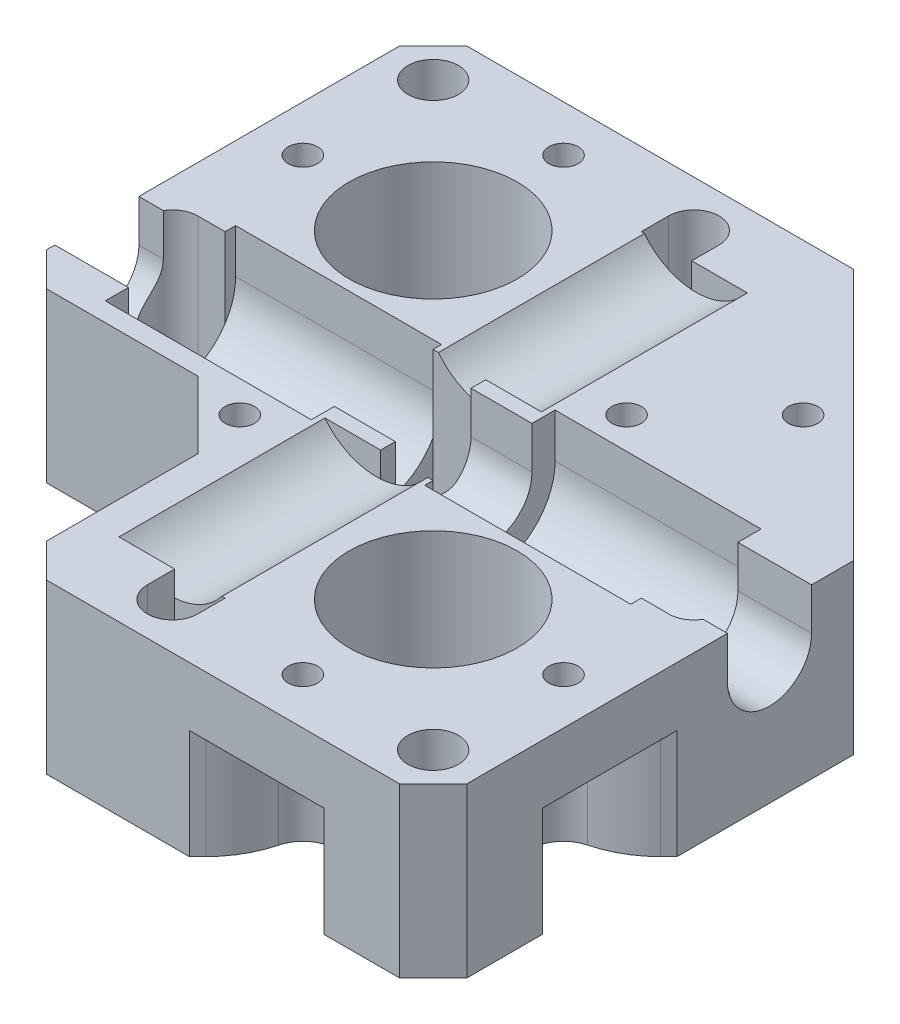
from build123d import *
from build123d.topology import SkipClean

# Parameters (mm, degrees)
SKETCH1_W               = 80
SKETCH1_H               = 80
BOSS_EXTRUDE1_DEPTH     = 20
CUT_EXTRUDE1_DEPTH      = 61
CUT_EXTRUDE1_DEPTH_BACK = 61
SKETCH2_R               = 1.75
SKETCH3_W               = 24.5
SKETCH3_H               = 15.5
CUT_EXTRUDE2_DEPTH      = 13
FILLET1_R               = 7.75
SKETCH4_W               = 15.5
SKETCH4_H               = 24.5
CUT_EXTRUDE3_DEPTH      = 3
BOSS_EXTRUDE2_DEPTH     = 23.5
CUT_EXTRUDE4_DEPTH      = 61
CUT_EXTRUDE4_DEPTH_BACK = 61
CUT_EXTRUDE5_DEPTH      = 61
CUT_EXTRUDE5_DEPTH_BACK = 61
SKETCH7_R               = 10
BOSS_EXTRUDE3_DEPTH     = 1.5
CUT_EXTRUDE6_DEPTH      = 61
CUT_EXTRUDE6_DEPTH_BACK = 61
CHAMFER1_SIZE           = 4
CHAMFER2_SIZE           = 30
CUT_EXTRUDE7_DEPTH      = 61
CUT_EXTRUDE7_DEPTH_BACK = 61
SKETCH10_R              = 1.75
SKETCH12_R              = 3
SKETCH12_R_2            = 1.75
CUT_EXTRUDE12_DEPTH     = 8
CUT_EXTRUDE13_START     = -3
SKETCH13_R              = 11
SKETCH13_R_2            = 10
CUT_EXTRUDE13_DEPTH     = 3
CUT_EXTRUDE14_START     = -16
SKETCH14_R              = 1.75
CUT_EXTRUDE14_DEPTH     = 16
CUT_EXTRUDE15_START     = -13
SKETCH15_R              = 1.75
SKETCH15_W              = 8
SKETCH15_H              = 5.5
SKETCH15_R_2            = 4
SKETCH15_W_2            = 5.5
SKETCH15_H_2            = 8
CUT_EXTRUDE15_DEPTH     = 13
CHAMFER3_SIZE           = 4
FILLET2_R               = 12
CUT_EXTRUDE19_DEPTH     = 17


# Some blends are built 0.0001 mm under size
with BuildPart() as part:
    # Sketch1 → Boss-Extrude1 (new body)
    with BuildSketch(Plane(origin=(0, 0, 0), x_dir=(1, 0, 0), z_dir=(0, 1, 0))):
        Rectangle(SKETCH1_W, SKETCH1_H)
    extrude(amount=-BOSS_EXTRUDE1_DEPTH)

    # Sketch2 → Cut-Extrude1 (cut, two sides: drawn at the far end of the back side and taken through both)
    with BuildSketch(Plane(origin=(0, 0, 0), x_dir=(1, 0, 0), z_dir=(0, 1, 0)).offset(-CUT_EXTRUDE1_DEPTH_BACK)):
        with Locations(Location((-11.5, -11.5, 0), (0, 0, 270))):
            Circle(SKETCH2_R)
        with Locations(Location((11.5, 11.5, 0), (0, 0, 270))):
            Circle(SKETCH2_R)
        with Locations(Location((22, 22, 0), (0, 0, 270))):
            Circle(SKETCH2_R)
        with Locations(Location((19, -34.5, 0), (0, 0, 270))):
            Circle(SKETCH2_R)
        with Locations(Location((34.5, -19, 0), (0, 0, 270))):
            Circle(SKETCH2_R)
        with Locations(Location((-34.5, 19, 0), (0, 0, 270))):
            Circle(SKETCH2_R)
        with Locations(Location((-19, 34.5, 0), (0, 0, 270))):
            Circle(SKETCH2_R)
    extrude(amount=CUT_EXTRUDE1_DEPTH + CUT_EXTRUDE1_DEPTH_BACK, mode=Mode.SUBTRACT)

    # Sketch3 → Cut-Extrude2 (cut)
    with BuildSketch(Plane(origin=(0, 0, 0), x_dir=(1, 0, 0), z_dir=(0, 1, 0))):
        with Locations((19, 0)):
            Rectangle(SKETCH3_W, SKETCH3_H)
        with Locations((-19, 0)):
            Rectangle(SKETCH3_W, SKETCH3_H)
    extrude(amount=-CUT_EXTRUDE2_DEPTH, mode=Mode.SUBTRACT)

    # Fillet1
    fillet1_edges = [part.edges().sort_by_distance(p)[0] for p in [
        (19, -13, 7.75),
        (19, -13, -7.75),
        (-19, -13, 7.75),
        (-19, -13, -7.75),
    ]]
    fillet(fillet1_edges, radius=FILLET1_R - 0.0001)  # a hair under: the kernel refuses the full size

    # Sketch4 → Cut-Extrude3 (cut)
    with BuildSketch(Plane(origin=(0, 0, 0), x_dir=(1, 0, 0), z_dir=(0, 1, 0))):
        with Locations((0, -19)):
            Rectangle(SKETCH4_W, SKETCH4_H)
        with Locations((0, 19)):
            Rectangle(SKETCH4_W, SKETCH4_H)
    extrude(amount=-CUT_EXTRUDE3_DEPTH, mode=Mode.SUBTRACT)

    # Sketch5 → Boss-Extrude2 (add)
    with BuildSketch(Plane(origin=(0, 0, 31.25), x_dir=(-1, 0, 0), z_dir=(0, 0, -1))):
        with BuildLine():
            ThreePointArc((-8e-09, -3), (-3.409545428, -2.209705452), (-6.123724357, 0))
            Line((-6.123724357, 0), (-7.75, 0))
            Line((-7.75, 0), (-7.75, -3))
            Line((-7.75, -3), (-8e-09, -3))
        make_face()
        with BuildLine():
            Line((7.75, -3), (7.75, 0))
            Line((7.75, 0), (6.123724357, 0))
            ThreePointArc((6.123724357, 0), (3.409545421, -2.209705455), (-8e-09, -3))
            Line((-8e-09, -3), (7.75, -3))
        make_face()
    boss_extrude2 = extrude(amount=BOSS_EXTRUDE2_DEPTH)

    # Mirror1: Boss-Extrude2 across plane
    add(boss_extrude2.mirror(Plane.XY))

    # Sketch6 → Cut-Extrude4 (cut, two sides: drawn at the far end of the back side and taken through both)
    with BuildSketch(Plane(origin=(0, 0, 0), x_dir=(0, 0, -1), z_dir=(1, 0, 0)).offset(-CUT_EXTRUDE4_DEPTH_BACK)):
        with BuildLine():
            ThreePointArc((-5, -5), (0, -10), (5, -5))
            Line((5, -5), (-5, -5))
        make_face()
        with BuildLine():
            Line((-5, -5), (5, -5))
            ThreePointArc((5, -5), (3.535533906, -1.464466094), (0, 0))
            ThreePointArc((0, 0), (-3.535533906, -1.464466094), (-5, -5))
        make_face()
        with BuildLine():
            Line((-5, 0), (-5, -5))
            ThreePointArc((-5, -5), (-3.535533906, -1.464466094), (0, 0))
            Line((0, 0), (-5, 0))
        make_face()
        with BuildLine():
            ThreePointArc((0, 0), (3.535533906, -1.464466094), (5, -5))
            Line((5, -5), (5, 0))
            Line((5, 0), (0, 0))
        make_face()
    extrude(amount=CUT_EXTRUDE4_DEPTH + CUT_EXTRUDE4_DEPTH_BACK, mode=Mode.SUBTRACT)

    # Sketch7 → Cut-Extrude5 (cut, two sides: drawn at the far end of the back side and taken through both)
    with BuildSketch(Plane(origin=(0, 0, 0), x_dir=(1, 0, 0), z_dir=(0, 1, 0)).offset(-CUT_EXTRUDE5_DEPTH_BACK)):
        with Locations(Location((19, -19, 0), (0, 0, 270))):
            Circle(SKETCH7_R)
        with Locations(Location((-19, 19, 0), (0, 0, 270))):
            Circle(SKETCH7_R)
    extrude(amount=CUT_EXTRUDE5_DEPTH + CUT_EXTRUDE5_DEPTH_BACK, mode=Mode.SUBTRACT)

    # Sketch8 → Boss-Extrude3 (add)
    with BuildSketch(Plane(origin=(0, 0, -6.75), x_dir=(-1, 0, 0), z_dir=(0, 0, -1))):
        with BuildLine():
            ThreePointArc((0, -3), (-3.409545424, -2.209705454), (-6.123724357, 0))
            Line((-6.123724357, 0), (-6.75, 0))
            Line((-6.75, 0), (-6.75, -3))
            Line((-6.75, -3), (0, -3))
        make_face()
        with BuildLine():
            Line((6.75, -3), (6.75, 0))
            Line((6.75, 0), (6.123724357, 0))
            ThreePointArc((6.123724357, 0), (3.409545424, -2.209705454), (0, -3))
            Line((0, -3), (6.75, -3))
        make_face()
    boss_extrude3 = extrude(amount=BOSS_EXTRUDE3_DEPTH)

    # Mirror2: Boss-Extrude3 across plane
    add(boss_extrude3.mirror(Plane.XY))

    # Sketch9 → Cut-Extrude6 (cut, two sides: drawn at the far end of the back side and taken through both)
    with BuildSketch(Plane(origin=(0, 0, 0), x_dir=(1, 0, 0), z_dir=(0, 1, 0)).offset(-CUT_EXTRUDE6_DEPTH_BACK)):
        Polygon((-10, -18), (-18, -10), (-18, -18), align=None)
        Polygon((-10, -40), (-10, -18), (-18, -18), (-18, -10), (-40, -10), (-40, -40), align=None)
    extrude(amount=CUT_EXTRUDE6_DEPTH + CUT_EXTRUDE6_DEPTH_BACK, mode=Mode.SUBTRACT)

    # Chamfer1
    chamfer1_edges = [part.edges().sort_by_distance(p)[0] for p in [
        (-10, -10, 40),
        (-40, -10, 10),
        (40, -10, 40),
        (-40, -10, -40),
    ]]
    chamfer(chamfer1_edges, length=CHAMFER1_SIZE)

    # Chamfer2
    chamfer2_edges = [part.edges().sort_by_distance(p)[0] for p in [
        (40, -10, -40),
    ]]
    chamfer(chamfer2_edges, length=CHAMFER2_SIZE)

    # Sketch10 → Cut-Extrude7 (cut, two sides: drawn at the far end of the back side and taken through both)
    with BuildSketch(Plane(origin=(0, 0, 0), x_dir=(1, 0, 0), z_dir=(0, 1, 0)).offset(-CUT_EXTRUDE7_DEPTH_BACK)):
        with Locations(Location((3.5, -3.5, 0), (0, 0, 270))):
            Circle(SKETCH10_R)
        with Locations(Location((-3.5, 3.5, 0), (0, 0, 270))):
            Circle(SKETCH10_R)
        with Locations(Location((34.5, -3.5, 0), (0, 0, 270))):
            Circle(SKETCH10_R)
        with Locations(Location((3.5, -34.5, 0), (0, 0, 270))):
            Circle(SKETCH10_R)
        with Locations(Location((34.5, -34.5, 0), (0, 0, 270))):
            Circle(SKETCH10_R)
        with Locations(Location((-3.5, 34.5, 0), (0, 0, 270))):
            Circle(SKETCH10_R)
        with Locations(Location((-34.5, 3.5, 0), (0, 0, 270))):
            Circle(SKETCH10_R)
        with Locations(Location((-34.5, 34.5, 0), (0, 0, 270))):
            Circle(SKETCH10_R)
    extrude(amount=CUT_EXTRUDE7_DEPTH + CUT_EXTRUDE7_DEPTH_BACK, mode=Mode.SUBTRACT)

    # Sketch12 → Cut-Extrude12 (cut)
    # profile 1 of 2: a face of its own
    with BuildSketch(Plane(origin=(0, 0, 0), x_dir=(1, 0, 0), z_dir=(0, 1, 0))):
        with Locations(Location((34.5, -34.5, 0), (0, 0, 270))):
            Circle(SKETCH12_R)
        with Locations(Location((34.5, -34.5, 0), (0, 0, 270))):
            Circle(SKETCH12_R_2, mode=Mode.SUBTRACT)
    # profile 2 of 2: a face of its own
    with BuildSketch(Plane(origin=(0, 0, 0), x_dir=(1, 0, 0), z_dir=(0, 1, 0))):
        with Locations(Location((-34.5, 34.5, 0), (0, 0, 270))):
            Circle(SKETCH12_R)
        with Locations(Location((-34.5, 34.5, 0), (0, 0, 270))):
            Circle(SKETCH12_R_2, mode=Mode.SUBTRACT)
    extrude(amount=-CUT_EXTRUDE12_DEPTH, mode=Mode.SUBTRACT)

    # Sketch13 → Cut-Extrude13 (cut)
    # profile 1 of 2: a face of its own
    with BuildSketch(Plane.XZ.offset(20).offset(CUT_EXTRUDE13_START)):
        with Locations(Location((19, 19, 0), (0, 0, 270))):
            Circle(SKETCH13_R)
        with Locations(Location((19, 19, 0), (0, 0, 270))):
            Circle(SKETCH13_R_2, mode=Mode.SUBTRACT)
    # profile 2 of 2: a face of its own
    with BuildSketch(Plane.XZ.offset(20).offset(CUT_EXTRUDE13_START)):
        with Locations(Location((-19, -19, 0), (0, 0, 270))):
            Circle(SKETCH13_R)
        with Locations(Location((-19, -19, 0), (0, 0, 270))):
            Circle(SKETCH13_R_2, mode=Mode.SUBTRACT)
    extrude(amount=CUT_EXTRUDE13_DEPTH, mode=Mode.SUBTRACT)

    # Sketch14 → Cut-Extrude14 (cut)
    # profile 1 of 7: a face of its own
    with BuildSketch(Plane.XZ.offset(20).offset(CUT_EXTRUDE14_START)):
        Polygon((-34.5, -15.824573519), (-37.25, -17.41228676), (-37.25, -20.58771324), (-34.5, -22.175426481), (-31.75, -20.58771324), (-31.75, -17.41228676), align=None)
        with Locations(Location((-34.5, -19, 0), (0, 0, 270))):
            Circle(SKETCH14_R, mode=Mode.SUBTRACT)
    # profile 2 of 7: a face of its own
    with BuildSketch(Plane.XZ.offset(20).offset(CUT_EXTRUDE14_START)):
        Polygon((-15.824573519, -34.5), (-17.41228676, -31.75), (-20.58771324, -31.75), (-22.175426481, -34.5), (-20.58771324, -37.25), (-17.41228676, -37.25), align=None)
        with Locations(Location((-19, -34.5, 0), (0, 0, 270))):
            Circle(SKETCH14_R, mode=Mode.SUBTRACT)
    # profile 3 of 7: a face of its own
    with BuildSketch(Plane.XZ.offset(20).offset(CUT_EXTRUDE14_START)):
        Polygon((34.5, 22.175426481), (31.75, 20.58771324), (31.75, 17.41228676), (34.5, 15.824573519), (37.25, 17.41228676), (37.25, 20.58771324), align=None)
        with Locations(Location((34.5, 19, 0), (0, 0, 270))):
            Circle(SKETCH14_R, mode=Mode.SUBTRACT)
    # profile 4 of 7: a face of its own
    with BuildSketch(Plane.XZ.offset(20).offset(CUT_EXTRUDE14_START)):
        Polygon((22.175426481, 34.5), (20.58771324, 37.25), (17.41228676, 37.25), (15.824573519, 34.5), (17.41228676, 31.75), (20.58771324, 31.75), align=None)
        with Locations(Location((19, 34.5, 0), (0, 0, 270))):
            Circle(SKETCH14_R, mode=Mode.SUBTRACT)
    # profile 5 of 7: a face of its own
    with BuildSketch(Plane.XZ.offset(20).offset(CUT_EXTRUDE14_START)):
        Polygon((-8.324573519, 11.5), (-9.91228676, 14.25), (-13.08771324, 14.25), (-14.675426481, 11.5), (-13.08771324, 8.75), (-9.91228676, 8.75), align=None)
        with Locations(Location((-11.5, 11.5, 0), (0, 0, 270))):
            Circle(SKETCH14_R, mode=Mode.SUBTRACT)
    # profile 6 of 7: a face of its own
    with BuildSketch(Plane.XZ.offset(20).offset(CUT_EXTRUDE14_START)):
        Polygon((8.324573519, -11.5), (9.91228676, -14.25), (13.08771324, -14.25), (14.675426481, -11.5), (13.08771324, -8.75), (9.91228676, -8.75), align=None)
        with Locations(Location((11.5, -11.5, 0), (0, 0, 270))):
            Circle(SKETCH14_R, mode=Mode.SUBTRACT)
    # profile 7 of 7: a face of its own
    with BuildSketch(Plane.XZ.offset(20).offset(CUT_EXTRUDE14_START)):
        Polygon((22, -18.824573519), (19.25, -20.41228676), (19.25, -23.58771324), (22, -25.175426481), (24.75, -23.58771324), (24.75, -20.41228676), align=None)
        with Locations(Location((22, -22, 0), (0, 0, 270))):
            Circle(SKETCH14_R, mode=Mode.SUBTRACT)
    extrude(amount=CUT_EXTRUDE14_DEPTH, mode=Mode.SUBTRACT)

    # Sketch15 → Cut-Extrude15 (cut)
    # profile 1 of 11: a face of its own
    with BuildSketch(Plane.XZ.offset(20).offset(CUT_EXTRUDE15_START)):
        with Locations(Location((11.5, -11.5, 0), (0, 0, 270))):
            Circle(SKETCH15_R)
    # profile 2 of 11: a face of its own
    with BuildSketch(Plane.XZ.offset(20).offset(CUT_EXTRUDE15_START)):
        Polygon((9.91228676, -14.25), (13.08771324, -8.75), (40, -10), (10, -40), align=None)
        with Locations(Location((22, -22, 0), (0, 0, 270))):
            Circle(SKETCH15_R, mode=Mode.SUBTRACT)
    # profile 3 of 11: a face of its own
    with BuildSketch(Plane.XZ.offset(20).offset(CUT_EXTRUDE15_START)):
        with Locations((-19, -37.25)):
            Rectangle(SKETCH15_W, SKETCH15_H)
    # profile 4 of 11: a face of its own
    with BuildSketch(Plane.XZ.offset(20).offset(CUT_EXTRUDE15_START)):
        with Locations((-19, -34.5)):
            Circle(SKETCH15_R_2)
    # profile 5 of 11: a face of its own
    with BuildSketch(Plane.XZ.offset(20).offset(CUT_EXTRUDE15_START)):
        with Locations((-34.5, -19)):
            Circle(SKETCH15_R_2)
    # profile 6 of 11: a face of its own
    with BuildSketch(Plane.XZ.offset(20).offset(CUT_EXTRUDE15_START)):
        with Locations((-37.25, -19)):
            Rectangle(SKETCH15_W_2, SKETCH15_H_2)
    # profile 7 of 11: a face of its own
    with BuildSketch(Plane.XZ.offset(20).offset(CUT_EXTRUDE15_START)):
        Polygon((-18, 10), (-10, 18), (-8.324573519, 11.5), (-13.08771324, 8.75), align=None)
    # profile 8 of 11: a face of its own
    with BuildSketch(Plane.XZ.offset(20).offset(CUT_EXTRUDE15_START)):
        with Locations((34.5, 19)):
            Circle(SKETCH15_R_2)
    # profile 9 of 11: a face of its own
    with BuildSketch(Plane.XZ.offset(20).offset(CUT_EXTRUDE15_START)):
        with Locations((37.25, 19)):
            Rectangle(SKETCH15_W_2, SKETCH15_H_2)
    # profile 10 of 11: a face of its own
    with BuildSketch(Plane.XZ.offset(20).offset(CUT_EXTRUDE15_START)):
        with Locations((19, 34.5)):
            Circle(SKETCH15_R_2)
    # profile 11 of 11: a face of its own
    with BuildSketch(Plane.XZ.offset(20).offset(CUT_EXTRUDE15_START)):
        with Locations((19, 37.25)):
            Rectangle(SKETCH15_W, SKETCH15_H)
    extrude(amount=CUT_EXTRUDE15_DEPTH, mode=Mode.SUBTRACT)

    # Chamfer3
    chamfer3_edges = [part.edges().sort_by_distance(p)[0] for p in [
        (-15, -13.5, -40),
        (-23, -13.5, -40),
        (40, -13.5, 23),
        (40, -13.5, 15),
        (15, -13.5, 40),
        (23, -13.5, 40),
        (-40, -13.5, -23),
        (-40, -13.5, -15),
    ]]
    chamfer(chamfer3_edges, length=CHAMFER3_SIZE)

    # Fillet2
    # the kernel refuses this fillet: 12 mm, written as the material it takes off along each edge
    with BuildSketch(Plane(origin=(15, -7, 36), x_dir=(0.05014793839009291, 0, -0.9987418006047526), z_dir=(0, -1, 0)), Plane(origin=(36, -7, 23), x_dir=(-0.9987418006047525, 0, -0.0501479383900949), z_dir=(0, -1, 0)), Plane(origin=(-15, -7, -36), x_dir=(-0.05014793839009234, 0, 0.9987418006047526), z_dir=(0, -1, 0)), Plane(origin=(-36, -7, -23), x_dir=(0.9987418006047526, 0, 0.050147938390093766), z_dir=(0, -1, 0))) as fillet2_piece_1:
        with BuildLine():
            CenterArc((4.887677515, -11.759235885), FILLET2_R, 101.496660345, 30.62886878)
            Line((-3.161408316, -2.859111319), (-3.966316899, -1.969098862))
            Line((-3.966316899, -1.969098862), (-0.804908583, 0.890012457))
            Line((-0.804908583, 0.890012457), (0.060177526, 1.198490161))
            ThreePointArc((0.060177526, 1.198490161), (1.558290227, 1.123268253), (2.25677474, 1.175923588))
            Line((2.25677474, 1.175923588), (2.495947719, 0))
        make_face()
    extrude(amount=23.656283379, mode=Mode.SUBTRACT)
    with BuildSketch(Plane(origin=(23, -7, 36), x_dir=(0.7071067811865476, 0, 0.7071067811865476), z_dir=(0, -1, 0)), Plane(origin=(36, -7, 15), x_dir=(0.707106781186547, 0, -0.7071067811865479), z_dir=(0, -1, 0)), Plane(origin=(-23, -7, -36), x_dir=(-0.7071067811865475, 0, -0.7071067811865475), z_dir=(0, -1, 0)), Plane(origin=(-36, -7, -15), x_dir=(-0.7071067811865476, 0, 0.7071067811865476), z_dir=(0, -1, 0))) as fillet2_piece_2:
        with BuildLine():
            CenterArc((4.262513352, -12), FILLET2_R, 90, 30.62886878)
            Line((-1.851187134, -1.674174785), (-2.462557183, -0.641592264))
            ThreePointArc((-2.462557183, -0.641592264), (-1.909188309, -0.212132034), (-0.848528137, 0.848528137))
            Line((-0.848528137, 0.848528137), (0, 1.2))
            Line((0, 1.2), (4.262513352, 1.2))
            Line((4.262513352, 1.2), (4.262513352, 0))
        make_face()
    extrude(amount=23.656283379, mode=Mode.SUBTRACT)

    # Sketch19 → Cut-Extrude19 (cut)
    with SkipClean():  # the faces are left unmerged after this step: merging them gives an invalid solid
        with BuildSketch(Plane(origin=(0, 0, 0), x_dir=(1, 0, 0), z_dir=(0, 1, 0))):
            with BuildLine():
                ThreePointArc((3.5, -6.5), (5.621320344, -5.621320344), (6.5, -3.5))
                Line((6.5, -3.5), (5.25, -3.5))
                ThreePointArc((5.25, -3.5), (4.737436867, -4.737436867), (3.5, -5.25))
                Line((3.5, -5.25), (3.5, -6.5))
            make_face()
            with BuildLine():
                Line((5.25, -3.5), (6.5, -3.5))
                ThreePointArc((6.5, -3.5), (5.621320344, -1.378679656), (3.5, -0.5))
                Line((3.5, -0.5), (3.5, -1.75))
                ThreePointArc((3.5, -1.75), (4.737436867, -2.262563133), (5.25, -3.5))
            make_face()
            with BuildLine():
                Line((3.5, -1.75), (3.5, -0.5))
                ThreePointArc((3.5, -0.5), (1.378679656, -1.378679656), (0.5, -3.5))
                Line((0.5, -3.5), (1.75, -3.5))
                ThreePointArc((1.75, -3.5), (2.262563133, -2.262563133), (3.5, -1.75))
            make_face()
            with BuildLine():
                ThreePointArc((0.5, -3.5), (1.378679656, -5.621320344), (3.5, -6.5))
                Line((3.5, -6.5), (3.5, -5.25))
                ThreePointArc((3.5, -5.25), (2.262563133, -4.737436867), (1.75, -3.5))
                Line((1.75, -3.5), (0.5, -3.5))
            make_face()
            with BuildLine():
                Line((6.5, -6.75), (6.5, -3.5))
                ThreePointArc((6.5, -3.5), (5.621320344, -5.621320344), (3.5, -6.5))
                Line((3.5, -6.5), (3.5, -6.75))
                Line((3.5, -6.75), (6.5, -6.75))
            make_face()
            with BuildLine():
                Line((3.5, -6.75), (3.5, -6.5))
                ThreePointArc((3.5, -6.5), (1.378679656, -5.621320344), (0.5, -3.5))
                Line((0.5, -3.5), (0.5, -6.75))
                Line((0.5, -6.75), (3.5, -6.75))
            make_face()
            with BuildLine():
                ThreePointArc((-3.5, 5.25), (-2.262563133, 4.737436867), (-1.75, 3.5))
                Line((-1.75, 3.5), (-0.5, 3.5))
                ThreePointArc((-0.5, 3.5), (-1.378679656, 5.621320344), (-3.5, 6.5))
                Line((-3.5, 6.5), (-3.5, 5.25))
            make_face()
            with BuildLine():
                Line((-0.5, 3.5), (-1.75, 3.5))
                ThreePointArc((-1.75, 3.5), (-2.262563133, 2.262563133), (-3.5, 1.75))
                Line((-3.5, 1.75), (-3.5, 0.5))
                ThreePointArc((-3.5, 0.5), (-1.378679656, 1.378679656), (-0.5, 3.5))
            make_face()
            with BuildLine():
                ThreePointArc((-5.25, 3.5), (-4.737436867, 4.737436867), (-3.5, 5.25))
                Line((-3.5, 5.25), (-3.5, 6.5))
                ThreePointArc((-3.5, 6.5), (-5.621320344, 5.621320344), (-6.5, 3.5))
                Line((-6.5, 3.5), (-5.25, 3.5))
            make_face()
            with BuildLine():
                Line((-3.5, 0.5), (-3.5, 1.75))
                ThreePointArc((-3.5, 1.75), (-4.737436867, 2.262563133), (-5.25, 3.5))
                Line((-5.25, 3.5), (-6.5, 3.5))
                ThreePointArc((-6.5, 3.5), (-5.621320344, 1.378679656), (-3.5, 0.5))
            make_face()
            with BuildLine():
                Line((-6.75, 0.5), (-3.5, 0.5))
                ThreePointArc((-3.5, 0.5), (-5.621320344, 1.378679656), (-6.5, 3.5))
                Line((-6.5, 3.5), (-6.5, 6.75))
                Line((-6.5, 6.75), (-6.75, 6.75))
                Line((-6.75, 6.75), (-6.75, 0.5))
            make_face()
            with BuildLine():
                ThreePointArc((-6.5, 3.5), (-5.621320344, 5.621320344), (-3.5, 6.5))
                Line((-3.5, 6.5), (-3.5, 6.75))
                Line((-3.5, 6.75), (-6.5, 6.75))
                Line((-6.5, 6.75), (-6.5, 3.5))
            make_face()
            with BuildLine():
                ThreePointArc((-3.5, 6.5), (-1.378679656, 5.621320344), (-0.5, 3.5))
                Line((-0.5, 3.5), (-0.5, 6.75))
                Line((-0.5, 6.75), (-3.5, 6.75))
                Line((-3.5, 6.75), (-3.5, 6.5))
            make_face()
            with BuildLine():
                ThreePointArc((3.5, -0.5), (5.621320344, -1.378679656), (6.5, -3.5))
                Line((6.5, -3.5), (6.5, -6.75))
                Line((6.5, -6.75), (6.75, -6.75))
                Line((6.75, -6.75), (6.75, -0.5))
                Line((6.75, -0.5), (3.5, -0.5))
            make_face()
            with BuildLine():
                ThreePointArc((37.5, -3.5), (36.621320344, -1.378679656), (34.5, -0.5))
                Line((34.5, -0.5), (34.5, -1.75))
                ThreePointArc((34.5, -1.75), (35.737436867, -2.262563133), (36.25, -3.5))
                ThreePointArc((36.25, -3.5), (35.737436867, -4.737436867), (34.5, -5.25))
                Line((34.5, -5.25), (34.5, -6.487538509))
                Line((34.5, -6.487538509), (34.226844996, -6.487538509))
                ThreePointArc((34.226844996, -6.487538509), (36.522440974, -5.715791621), (37.5, -3.5))
            make_face()
            with BuildLine():
                Line((34.5, -1.75), (34.5, -0.5))
                ThreePointArc((34.5, -0.5), (31.503116992, -3.363280447), (34.226844996, -6.487538509))
                Line((34.226844996, -6.487538509), (34.5, -6.487538509))
                Line((34.5, -6.487538509), (34.5, -5.25))
                ThreePointArc((34.5, -5.25), (32.75, -3.5), (34.5, -1.75))
            make_face()
            with BuildLine():
                ThreePointArc((34.226844996, -6.487538509), (31.503116992, -3.363280447), (34.5, -0.5))
                Line((34.5, -0.5), (31.25, -0.5))
                Line((31.25, -0.5), (31.25, -6.487538509))
                Line((31.25, -6.487538509), (34.226844996, -6.487538509))
            make_face()
            with BuildLine():
                ThreePointArc((0.5, -34.5), (3.5, -37.5), (6.5, -34.5))
                Line((6.5, -34.5), (5.25, -34.5))
                ThreePointArc((5.25, -34.5), (3.5, -36.25), (1.75, -34.5))
                Line((1.75, -34.5), (0.5, -34.5))
            make_face()
            with BuildLine():
                Line((5.25, -34.5), (6.5, -34.5))
                ThreePointArc((6.5, -34.5), (3.5, -31.5), (0.5, -34.5))
                Line((0.5, -34.5), (1.75, -34.5))
                ThreePointArc((1.75, -34.5), (3.5, -32.75), (5.25, -34.5))
            make_face()
            with BuildLine():
                ThreePointArc((0.5, -34.5), (3.5, -31.5), (6.5, -34.5))
                Line((6.5, -34.5), (6.5, -31.25))
                Line((6.5, -31.25), (0.5, -31.25))
                Line((0.5, -31.25), (0.5, -34.5))
            make_face()
            with BuildLine():
                Line((-0.5, 31.25), (-0.5, 34.5))
                ThreePointArc((-0.5, 34.5), (-3.5, 31.5), (-6.5, 34.5))
                Line((-6.5, 34.5), (-6.5, 31.25))
                Line((-6.5, 31.25), (-0.5, 31.25))
            make_face()
            with BuildLine():
                ThreePointArc((-5.25, 34.5), (-3.5, 36.25), (-1.75, 34.5))
                Line((-1.75, 34.5), (-0.5, 34.5))
                ThreePointArc((-0.5, 34.5), (-3.5, 37.5), (-6.5, 34.5))
                Line((-6.5, 34.5), (-5.25, 34.5))
            make_face()
            with BuildLine():
                Line((-0.5, 34.5), (-1.75, 34.5))
                ThreePointArc((-1.75, 34.5), (-3.5, 32.75), (-5.25, 34.5))
                Line((-5.25, 34.5), (-6.5, 34.5))
                ThreePointArc((-6.5, 34.5), (-3.5, 31.5), (-0.5, 34.5))
            make_face()
            with BuildLine():
                ThreePointArc((-31.5, 3.5), (-32.378679656, 1.378679656), (-34.5, 0.5))
                Line((-34.5, 0.5), (-31.25, 0.5))
                Line((-31.25, 0.5), (-31.25, 6.5))
                Line((-31.25, 6.5), (-34.5, 6.5))
                ThreePointArc((-34.5, 6.5), (-32.378679656, 5.621320344), (-31.5, 3.5))
            make_face()
            with BuildLine():
                ThreePointArc((-34.5, 6.5), (-37.5, 3.5), (-34.5, 0.5))
                Line((-34.5, 0.5), (-34.5, 1.75))
                ThreePointArc((-34.5, 1.75), (-36.25, 3.5), (-34.5, 5.25))
                Line((-34.5, 5.25), (-34.5, 6.5))
            make_face()
            with BuildLine():
                Line((-34.5, 1.75), (-34.5, 0.5))
                ThreePointArc((-34.5, 0.5), (-32.378679656, 1.378679656), (-31.5, 3.5))
                ThreePointArc((-31.5, 3.5), (-32.378679656, 5.621320344), (-34.5, 6.5))
                Line((-34.5, 6.5), (-34.5, 5.25))
                ThreePointArc((-34.5, 5.25), (-33.262563133, 4.737436867), (-32.75, 3.5))
                ThreePointArc((-32.75, 3.5), (-33.262563133, 2.262563133), (-34.5, 1.75))
            make_face()
        extrude(amount=-CUT_EXTRUDE19_DEPTH, mode=Mode.SUBTRACT)
    add(part.part.scale(1), mode=Mode.REPLACE)  # the faces are merged on a copy


solid = part.part
